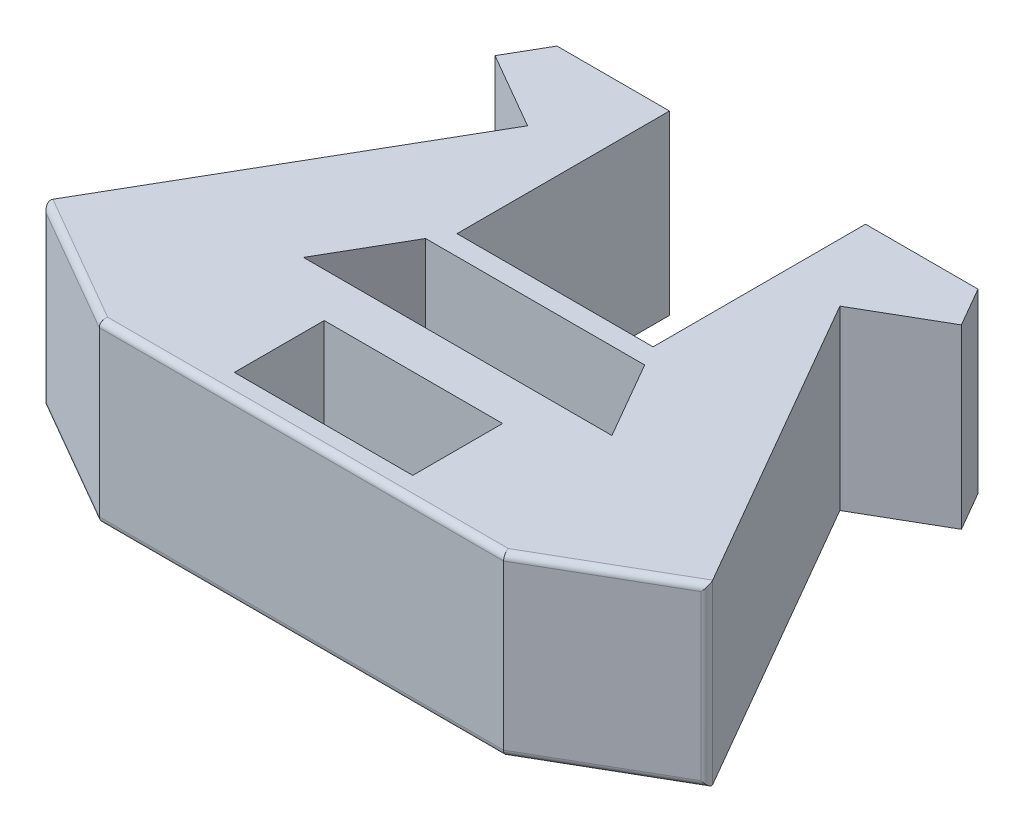
from build123d import *

# Parameters (mm, degrees)
SKETCH3_W           = 40.3
SKETCH3_H           = 20.3
BOSS_EXTRUDE1_DEPTH = 35
BOSS_EXTRUDE3_DEPTH = 5
FILLET3_R           = 1.5


with BuildPart() as part:
    # Sketch3 → Boss-Extrude1 (new body)
    with BuildSketch(Plane(origin=(0, 0, 0), x_dir=(1, 0, 0), z_dir=(0, 1, 0))):
        Polygon((-52.683687669, 10.05), (-35.276577053, 0), (-75.276577053, -69.282032303), (-45.673646539, -86.373292204), (45.673646539, -86.373292204), (75.276577053, -69.282032303), (35.276577053, 0), (52.683687669, 10.05), (47.558718033, 18.926707796), (22.15, 18.926707796), (22.15, -29.073292204), (-22.15, -29.073292204), (-22.15, 18.926707796), (-47.558718033, 18.926707796), align=None)
        with Locations((0, -71.223292204)):
            Rectangle(SKETCH3_W, SKETCH3_H, mode=Mode.SUBTRACT)
        Polygon((-24.748076211, -33.573292204), (-34.851705922, -51.073292204), (34.851705922, -51.073292204), (24.748076211, -33.573292204), align=None, mode=Mode.SUBTRACT)
    extrude(amount=BOSS_EXTRUDE1_DEPTH)

    # Sketch3<2> → Boss-Extrude3 (add)
    with BuildSketch(Plane(origin=(0, 0, 0), x_dir=(1, 0, 0), z_dir=(0, 1, 0))):
        Polygon((-47.558718033, 18.926707796), (-52.683687669, 10.05), (-35.276577053, 0), (-75.276577053, -69.282032303), (-45.673646539, -86.373292204), (45.673646539, -86.373292204), (75.276577053, -69.282032303), (35.276577053, 0), (52.683687669, 10.05), (47.558718033, 18.926707796), (22.15, 18.926707796), (22.15, -29.073292204), (-22.15, -29.073292204), (-22.15, 18.926707796), align=None)
    extrude(amount=-BOSS_EXTRUDE3_DEPTH)

    # Fillet3
    fillet3_edges = [part.edges().sort_by_distance(p)[0] for p in [
        (60.475111796, 35, 77.827662253),
        (-60.475111796, 35, 77.827662253),
        (60.475111796, -5, 77.827662253),
        (-60.475111796, -5, 77.827662253),
        (75.276577053, 15, 69.282032303),
        (-75.276577053, 15, 69.282032303),
        (0, 35, 86.373292204),
        (0, -5, 86.373292204),
    ]]
    fillet(fillet3_edges, radius=FILLET3_R)


solid = part.part
